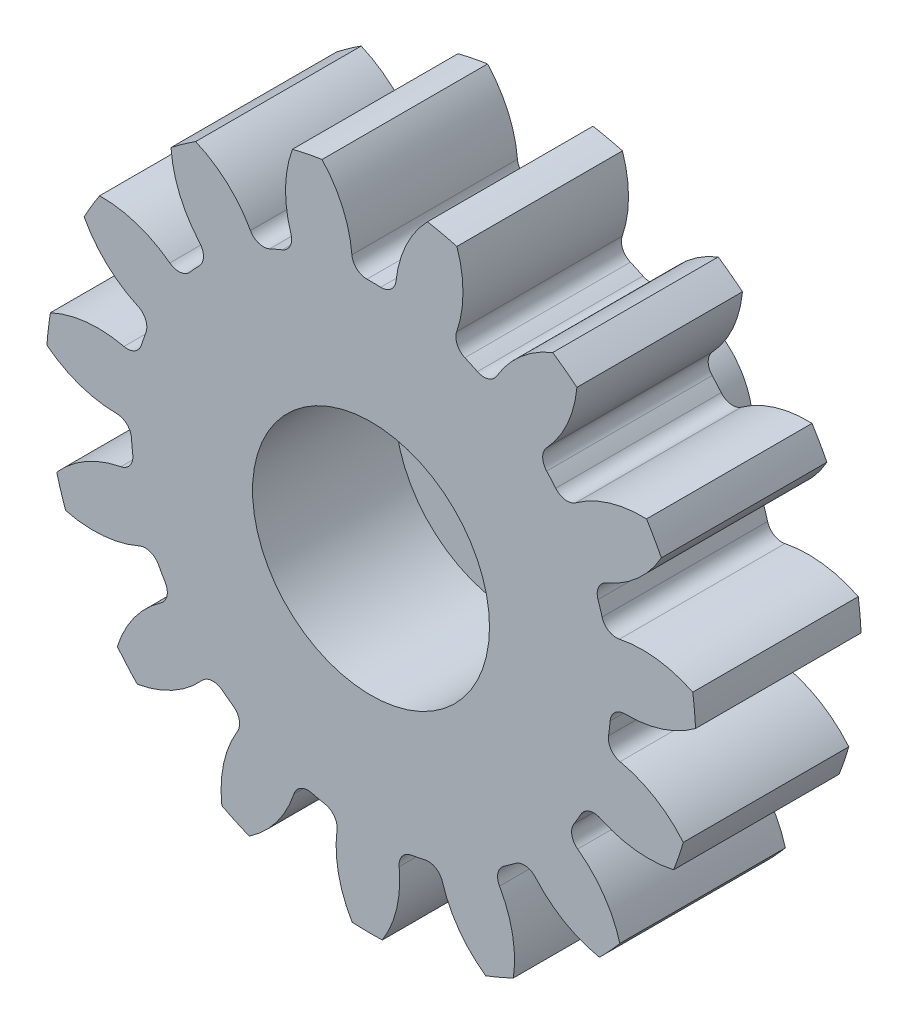
from build123d import *

# Parameters (mm, degrees)
SKETCH3_R          = 21.59
GEARBODY_DEPTH     = 11
TOOTHCUT_DEPTH     = 33.453908855
CIRPATTERN1_COUNT  = 15
BOREDIA_R          = 7.874
BORE_DEPTH         = 12700
SKETCH6_R          = 4.1
CUT_EXTRUDE1_DEPTH = 5.3


with BuildPart() as part:
    # Sketch3 → gearBody (new body)
    with BuildSketch(Plane.XY):
        Circle(SKETCH3_R)
    extrude(amount=GEARBODY_DEPTH)

    # Sketch2 → toothCut (cut, through all)
    with BuildSketch(Plane.XY):
        with BuildLine():
            ThreePointArc((15.783846764, -2.304552616), (15.843293638, -1.852249483), (15.889781974, -1.39843136))
            ThreePointArc((15.889781974, -1.39843136), (16.213055843, -0.751556907), (16.890861518, -0.499501321))
            ThreePointArc((16.890861518, -0.499501321), (20.504912911, 0.340315353), (23.283949955, 2.798691365))
            ThreePointArc((23.283949955, 2.798691365), (23.292901215, -2.723187818), (22.010467945, -8.09409042))
            ThreePointArc((22.010467945, -8.09409042), (19.873444675, -5.060974685), (16.550574786, -3.410158156))
            ThreePointArc((16.550574786, -3.410158156), (15.949189176, -3.008551507), (15.783846764, -2.304552616))
        make_face()
    toothcut = extrude(amount=TOOTHCUT_DEPTH, mode=Mode.SUBTRACT)

    # CirPattern1: toothCut ×15 about axis
    cirpattern1_axis = Axis((0, 0, 11), (0, 0, -1))
    for i in range(1, CIRPATTERN1_COUNT):
        add(toothcut.rotate(cirpattern1_axis, i * 360 / CIRPATTERN1_COUNT), mode=Mode.SUBTRACT)

    # boreDia → bore (cut, symmetric)
    with BuildSketch(Plane.XY):
        Circle(BOREDIA_R)
    extrude(amount=BORE_DEPTH, both=True, mode=Mode.SUBTRACT)

    # Sketch4 → Revolve1 (revolve)
    with BuildSketch(Plane(origin=(0, 0, 0), x_dir=(0, 0, -1), z_dir=(1, 0, 0))):
        with BuildLine():
            Line((0, 0), (9.525, 0))
            Line((9.525, 0), (9.525, 4.826))
            Line((9.525, 4.826), (5.588, 4.826))
            ThreePointArc((5.588, 4.826), (1.636687307, 6.462687307), (0, 10.414))
            Line((0, 10.414), (0, 7.874))
            Line((0, 7.874), (-1.524, 7.874))
            Line((-1.524, 7.874), (-1.524, 0))
            Line((-1.524, 0), (0, 0))
        make_face()
    revolve(axis=Axis((0, 0, 0), (0, 0, -1)))

    # Sketch6 → Cut-Extrude1 (cut)
    with BuildSketch(Plane(origin=(0, 0, -9.525), x_dir=(-1, 0, 0), z_dir=(0, 0, -1))):
        Circle(SKETCH6_R)
    extrude(amount=-CUT_EXTRUDE1_DEPTH, mode=Mode.SUBTRACT)


solid = part.part
